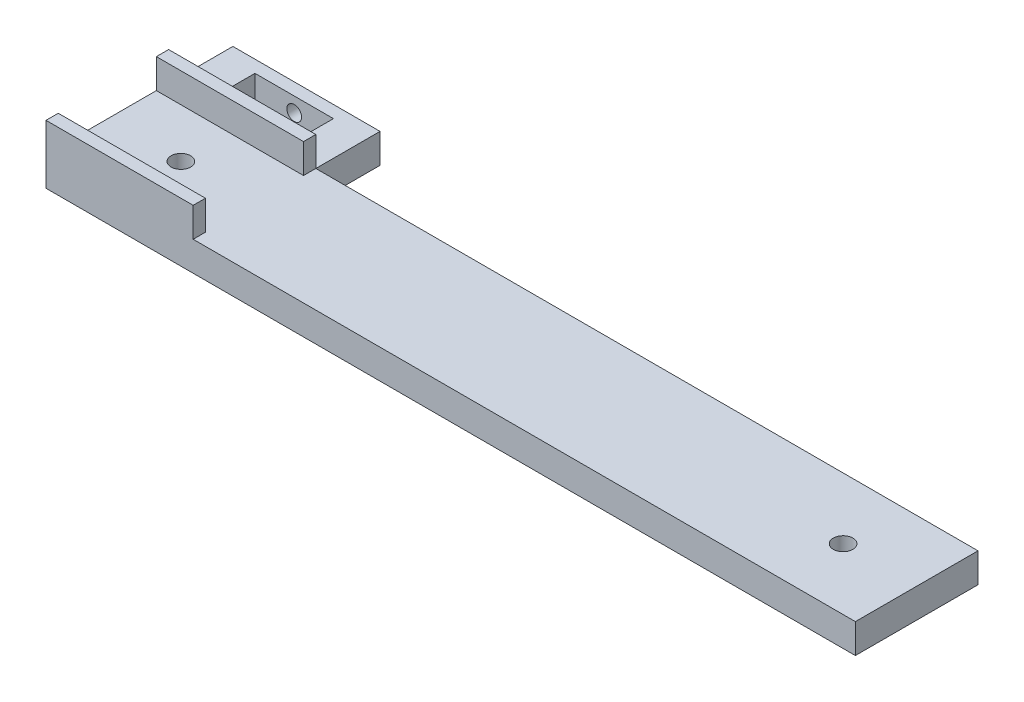
from build123d import *

# Parameters (mm, degrees)
SKETCH1_R           = 2
SKETCH1_W           = 16
SKETCH1_H           = 10.6
BOSS_EXTRUDE1_DEPTH = 6
SKETCH1_3_W         = 30
SKETCH1_3_H         = 2.5
BOSS_EXTRUDE2_DEPTH = 12
SKETCH3_R           = 1.5
CUT_EXTRUDE2_DEPTH  = 15.5
SKETCH2_R           = 2
CUT_EXTRUDE1_DEPTH  = 137.99361299


with BuildPart() as part:
    # Sketch1 → Boss-Extrude1 (new body)
    with BuildSketch(Plane(origin=(0, 0, 0), x_dir=(1, 0, 0), z_dir=(0, 1, 0))):
        Polygon((135, 2.5), (0, 2.5), (0, 15.6), (-30, 15.6), (-30, -22.5), (135, -22.5), align=None)
        with Locations((120, -10)):
            Circle(SKETCH1_R, mode=Mode.SUBTRACT)
        with Locations((-15, 7.8)):
            Rectangle(SKETCH1_W, SKETCH1_H, mode=Mode.SUBTRACT)
    extrude(amount=BOSS_EXTRUDE1_DEPTH)

    # Sketch1<3> → Boss-Extrude2 (add)
    with BuildSketch(Plane(origin=(0, 0, 0), x_dir=(1, 0, 0), z_dir=(0, 1, 0))):
        with Locations((-15, -21.25)):
            Rectangle(SKETCH1_3_W, SKETCH1_3_H)
        with Locations((-15, 1.25)):
            Rectangle(SKETCH1_3_W, SKETCH1_3_H)
    extrude(amount=BOSS_EXTRUDE2_DEPTH)

    # Sketch3 → Cut-Extrude2 (cut)
    with BuildSketch(Plane(origin=(0, 0, -15.6), x_dir=(-1, 0, 0), z_dir=(0, 0, -1))):
        with Locations((15, 3)):
            Circle(SKETCH3_R)
    extrude(amount=-CUT_EXTRUDE2_DEPTH, mode=Mode.SUBTRACT)

    # Sketch2 → Cut-Extrude1 (cut, through all)
    with BuildSketch(Plane(origin=(0, 6, 0), x_dir=(1, 0, 0), z_dir=(0, 1, 0))):
        with Locations((-15, -10)):
            Circle(SKETCH2_R)
    extrude(amount=-CUT_EXTRUDE1_DEPTH, mode=Mode.SUBTRACT)


solid = part.part
